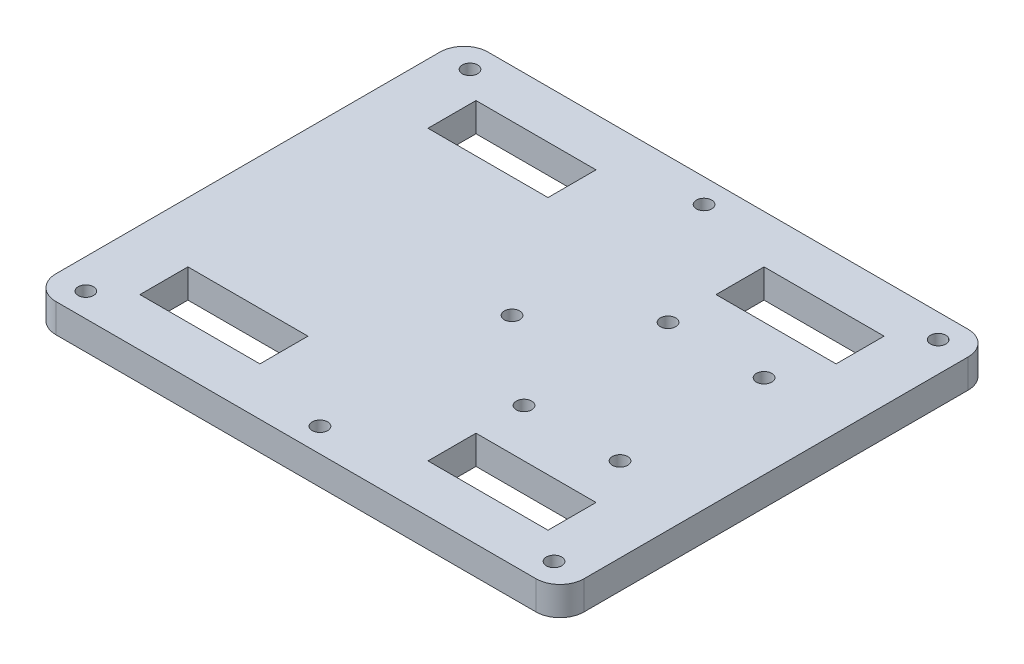
from build123d import *

# Parameters (mm, degrees)
SKETCH1_W               = 110
SKETCH1_H               = 90
BOSS_EXTRUDE1_DEPTH     = 6
SKETCH2_W               = 25
SKETCH2_H               = 10
CUT_EXTRUDE1_DEPTH      = 72.316197319
MIRROR2_COPY_1_SKETCH_W = 25
MIRROR2_COPY_1_SKETCH_H = 10
MIRROR2_COPY_1_DEPTH    = 72.316197319
M3_CLEARANCE_HOLE1_D    = 3.2
M3_CLEARANCE_HOLE2_D    = 3.2
FILLET1_R               = 5


with BuildPart() as part:
    # Sketch1 → Boss-Extrude1 (new body)
    with BuildSketch(Plane(origin=(0, 0, 0), x_dir=(1, 0, 0), z_dir=(0, 1, 0))):
        Rectangle(SKETCH1_W, SKETCH1_H)
    extrude(amount=BOSS_EXTRUDE1_DEPTH)

    # Sketch2 → Cut-Extrude1 (cut, through all)
    with BuildSketch(Plane(origin=(0, 6, 0), x_dir=(1, 0, 0), z_dir=(0, 1, 0))):
        with Locations((30, 30)):
            Rectangle(SKETCH2_W, SKETCH2_H)
    cut_extrude1 = extrude(amount=-CUT_EXTRUDE1_DEPTH, mode=Mode.SUBTRACT)

    # Mirror1: Cut-Extrude1 across plane
    add(cut_extrude1.mirror(Plane.XY), mode=Mode.SUBTRACT)

    # Mirror2: Cut-Extrude1 across plane
    add(cut_extrude1.mirror(Plane(origin=(0, 0, 0), x_dir=(0, 0, 1), z_dir=(1, 0, 0))), mode=Mode.SUBTRACT)

    # Mirror2 copy 1 sketch → Mirror2 copy 1 (cut, through all)
    with BuildSketch(Plane(origin=(0, 6, 0), x_dir=(-1, 0, 0), z_dir=(0, 1, 0))):
        with Locations((30, 30)):
            Rectangle(MIRROR2_COPY_1_SKETCH_W, MIRROR2_COPY_1_SKETCH_H)
    extrude(amount=-MIRROR2_COPY_1_DEPTH, mode=Mode.SUBTRACT)

    # M3 Clearance Hole1 (through all)
    with Locations(Plane(origin=(0, 6, 0), x_dir=(1, 0, 0), z_dir=(0, 1, 0))):
        with Locations((17.5, 15), (37.5, 15), (17.5, -15), (37.5, -15)):
            Hole(M3_CLEARANCE_HOLE1_D / 2)

    # M3 Clearance Hole2 (through all)
    with Locations(Plane(origin=(0, 6, 0), x_dir=(1, 0, 0), z_dir=(0, 1, 0))):
        with Locations((48.75, 40), (0, 40), (-48.75, 40), (-48.75, -40), (0, -40), (48.75, -40), (0, 0)):
            Hole(M3_CLEARANCE_HOLE2_D / 2)

    # Fillet1
    fillet1_edges = [part.edges().sort_by_distance(p)[0] for p in [
        (55, 3, 45),
        (-55, 3, 45),
        (55, 3, -45),
        (-55, 3, -45),
    ]]
    fillet(fillet1_edges, radius=FILLET1_R)


solid = part.part
